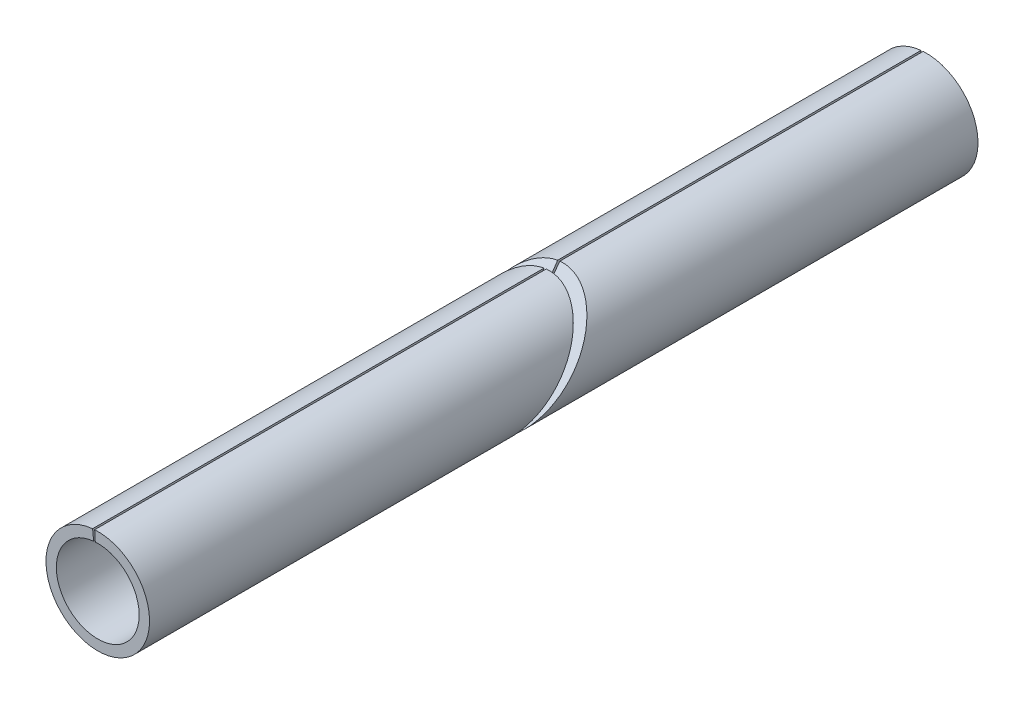
from build123d import *

# Parameters (mm, degrees)
LOFTED_BENDS1_DEPTH     = 101.6
CUT_EXTRUDE1_DEPTH      = 102.996102867
CUT_EXTRUDE1_DEPTH_BACK = 102.996102867


# Read off the part's stored shape, not the designer's step: Lofted Bends1
with BuildPart() as part:
    # Lofted Bends1 outline → Lofted Bends1 (new body)
    with BuildSketch(Plane.XY):
        with BuildLine():
            Line((-0.376838499, 6.338808464), (-0.301470799, 5.071046771))
            ThreePointArc((-0.301470799, 5.071046771), (0.40315195, -5.063977538), (-0.504670799, 5.05486967))
            Line((-0.504670799, 5.05486967), (-0.630838499, 6.318587088))
            ThreePointArc((-0.630838499, 6.318587088), (0.503939925, -6.329971924), (-0.376838499, 6.338808464))
        make_face()
    extrude(amount=LOFTED_BENDS1_DEPTH)

    # Sketch11 → Cut-Extrude1 (cut, two sides: drawn at the far end of the back side and taken through both)
    with BuildSketch(Plane(origin=(0, 0, 0), x_dir=(0, 0, -1), z_dir=(1, 0, 0)).offset(-CUT_EXTRUDE1_DEPTH_BACK)):
        Polygon((-62.898670134, -13.187969334), (-39.667045442, 14.012768356), (-38.701329866, 13.187969334), (-61.932954558, -14.012768356), align=None)
    extrude(amount=CUT_EXTRUDE1_DEPTH + CUT_EXTRUDE1_DEPTH_BACK, mode=Mode.SUBTRACT)


with BuildPart() as cut_extrude1_piece_1:
    # of the separate pieces the step leaves, piece 1, a body of its own (cut_extrude1_pieces)
    add(part.part.solids().sort_by_distance((-0.504670799, 5.05486967, 0))[0])


with BuildPart() as cut_extrude1_piece_2:
    # of the separate pieces the step leaves, piece 2, a body of its own (cut_extrude1_pieces)
    add(part.part.solids().sort_by_distance((-0.504670799, 5.05486967, 47.317813692))[0])


solid = Compound([cut_extrude1_piece_1.part, cut_extrude1_piece_2.part])
